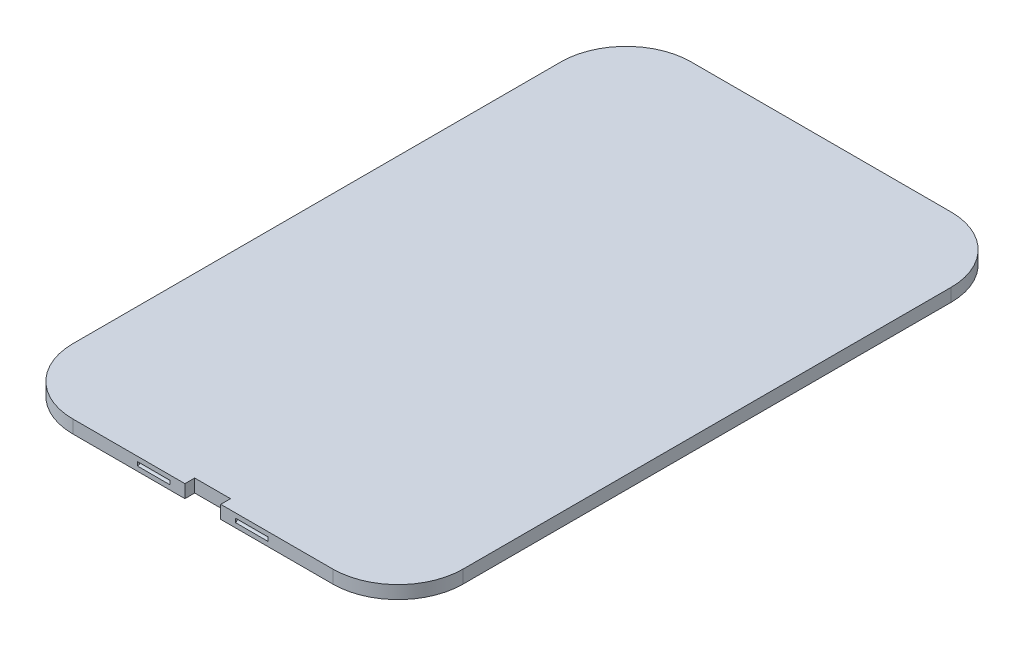
from build123d import *

# Parameters (mm, degrees)
TOP_DEPTH                 = 2.54
SKETCH13_W                = 12.446
SKETCH13_H                = 1.27
BODY_TABS_DEPTH           = 1.27
BODY_TABS_DRAFT           = 7
BODY_TABS_PROFILE_2_DEPTH = 1.27
BODY_TABS_PROFILE_2_DRAFT = 7
SKETCH14_W                = 6.985
SKETCH14_H                = 1.905
FLAT_HEAD_HOLE_DEPTH      = 73.383371188
SKETCH15_W                = 6.35
SKETCH15_H                = 0.762
HOLD_GRPOVES_DEPTH        = 0.381
HOLD_FILLETS_R            = 0.381


with BuildPart() as part:
    # Sketch2 → top (new body)
    with BuildSketch(Plane(origin=(0, 0, 0), x_dir=(1, 0, 0), z_dir=(0, 1, 0))):
        with BuildLine():
            Line((-25.3365, -60.2615), (25.3365, -60.2615))
            ThreePointArc((25.3365, -60.2615), (34.316756121, -56.541756121), (38.0365, -47.5615))
            Line((38.0365, -47.5615), (38.0365, 47.5615))
            ThreePointArc((38.0365, 47.5615), (34.316756121, 56.541756121), (25.3365, 60.2615))
            Line((25.3365, 60.2615), (-25.3365, 60.2615))
            ThreePointArc((-25.3365, 60.2615), (-34.316756121, 56.541756121), (-38.0365, 47.5615))
            Line((-38.0365, 47.5615), (-38.0365, -47.5615))
            ThreePointArc((-38.0365, -47.5615), (-34.316756121, -56.541756121), (-25.3365, -60.2615))
        make_face()
    extrude(amount=TOP_DEPTH)


with BuildPart() as body_tabs_tool:
    # Sketch13 → Body Tabs (with draft: the straight prism first)
    with BuildSketch(Plane(origin=(0, 0, -60.2615), x_dir=(-1, 0, 0), z_dir=(0, 0, -1))):
        with Locations((-12.7, 0.635)):
            Rectangle(SKETCH13_W, SKETCH13_H)
    extrude(amount=BODY_TABS_DEPTH)
    # Body Tabs: the draft: its side faces are tilted about the plane it starts from
    body_tabs_sides = [body_tabs_tool.faces().sort_by_distance(p)[0] for p in [
        (12.7, 0, -60.8965),
        (6.477, 0.635, -60.8965),
        (12.7, 1.27, -60.8965),
        (18.923, 0.635, -60.8965),
    ]]
    draft(body_tabs_sides, Plane(origin=(0, 0, -60.2615), x_dir=(-1, 0, 0), z_dir=(0, 0, -1)), BODY_TABS_DRAFT)


with BuildPart() as part_1:
    add(part.part)

    # Body Tabs: add body_tabs_tool
    add(body_tabs_tool.part)


with BuildPart() as body_tabs_profile_2_tool:
    # Sketch13 → Body Tabs profile 2 (with draft: the straight prism first)
    with BuildSketch(Plane(origin=(0, 0, -60.2615), x_dir=(-1, 0, 0), z_dir=(0, 0, -1))):
        with Locations((12.7, 0.635)):
            Rectangle(SKETCH13_W, SKETCH13_H)
    extrude(amount=BODY_TABS_PROFILE_2_DEPTH)
    # Body Tabs profile 2: the draft: its side faces are tilted about the plane it starts from
    body_tabs_profile_2_sides = [body_tabs_profile_2_tool.faces().sort_by_distance(p)[0] for p in [
        (-18.923, 0.635, -60.8965),
        (-12.7, 1.27, -60.8965),
        (-6.477, 0.635, -60.8965),
        (-12.7, 0, -60.8965),
    ]]
    draft(body_tabs_profile_2_sides, Plane(origin=(0, 0, -60.2615), x_dir=(-1, 0, 0), z_dir=(0, 0, -1)), BODY_TABS_PROFILE_2_DRAFT)


with BuildPart() as part_2:
    add(part_1.part)

    # Body Tabs profile 2: add body_tabs_profile_2_tool
    add(body_tabs_profile_2_tool.part)

    # Sketch14 → Flat Head Hole (cut, through all)
    with BuildSketch(Plane(origin=(0, 2.54, 0), x_dir=(1, 0, 0), z_dir=(0, 1, 0))):
        with Locations((0, -59.309)):
            Rectangle(SKETCH14_W, SKETCH14_H)
    extrude(amount=-FLAT_HEAD_HOLE_DEPTH, mode=Mode.SUBTRACT)

    # Sketch15 → Hold Grpoves (cut)
    with BuildSketch(Plane.XY.offset(60.2615)):
        with Locations((-9.525, 1.27)):
            Rectangle(SKETCH15_W, SKETCH15_H)
        with Locations((9.525, 1.27)):
            Rectangle(SKETCH15_W, SKETCH15_H)
    extrude(amount=-HOLD_GRPOVES_DEPTH, mode=Mode.SUBTRACT)

    # Hold Fillets
    hold_fillets_edges = [part_2.edges().sort_by_distance(p)[0] for p in [
        (9.525, 1.651, 59.8805),
        (9.525, 0.889, 59.8805),
        (-9.525, 0.889, 59.8805),
        (-9.525, 1.651, 59.8805),
    ]]
    fillet(hold_fillets_edges, radius=HOLD_FILLETS_R - 0.0001)  # a hair under: the kernel refuses the full size


solid = part_2.part
